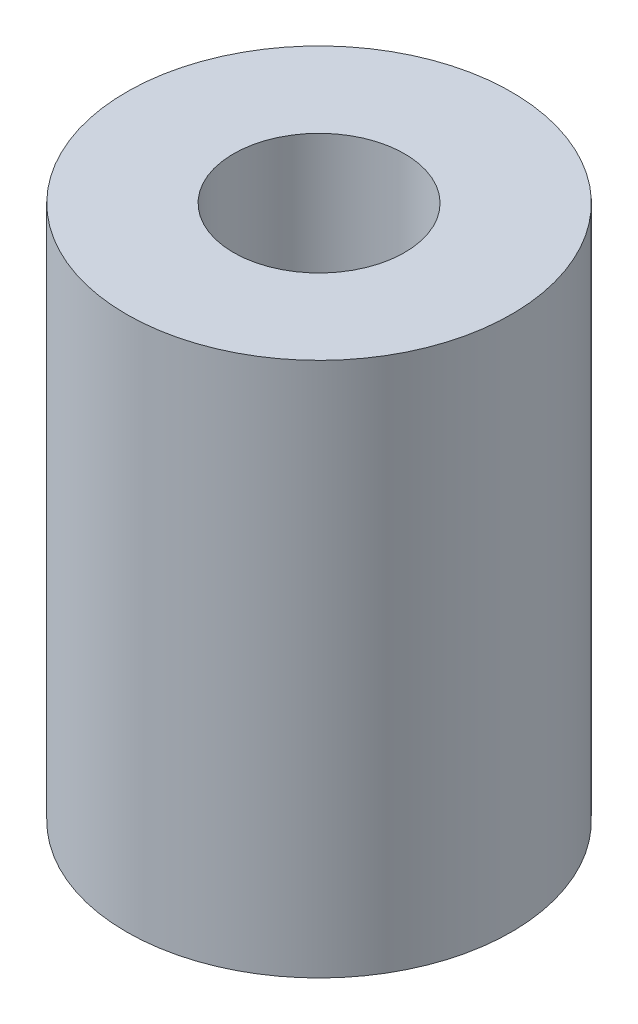
from build123d import *

# Parameters (mm, degrees)
SKETCH1_R           = 3.6
SKETCH1_R_2         = 1.6
BOSS_EXTRUDE1_DEPTH = 10


with BuildPart() as part:
    # Sketch1 → Boss-Extrude1 (new body)
    with BuildSketch(Plane(origin=(0, 0, 0), x_dir=(1, 0, 0), z_dir=(0, 1, 0))):
        Circle(SKETCH1_R)
        Circle(SKETCH1_R_2, mode=Mode.SUBTRACT)
    extrude(amount=BOSS_EXTRUDE1_DEPTH)


solid = part.part
